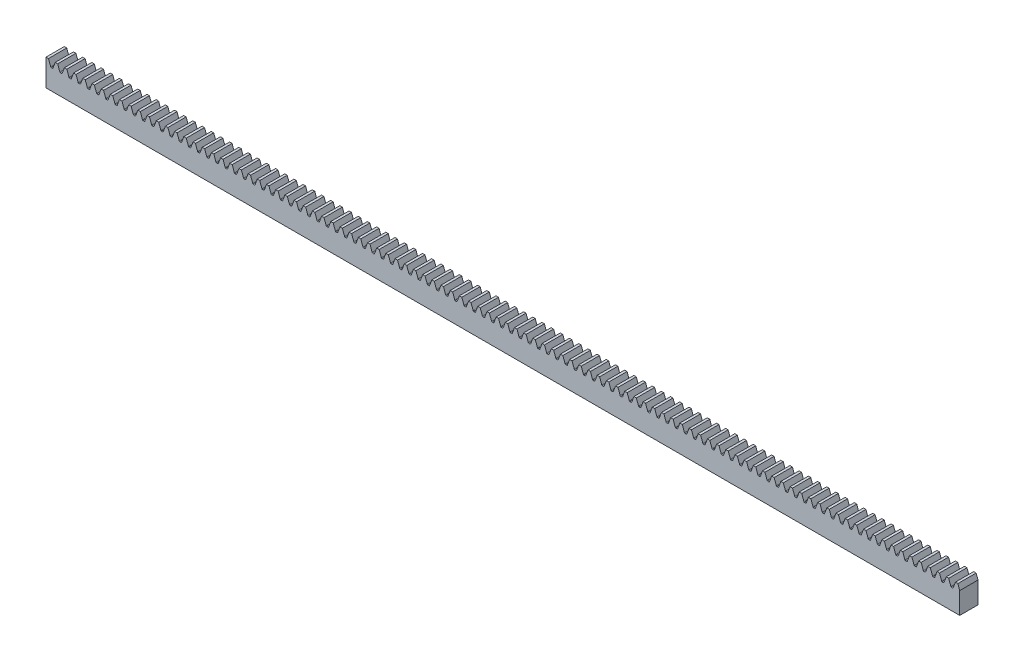
from build123d import *

# Parameters (mm, degrees)
BOSS_EXTRUDE1_DEPTH      = 125
BOSS_EXTRUDE1_DEPTH_BACK = 125
SKETCH3_W                = 5
SKETCH3_H                = 7.3
CUT_EXTRUDE1_DEPTH       = 126.078265498
FILLET1_R                = 0.167343945
LPATTERN1_START          = -2.5
LPATTERN1_DEPTH          = 5


# Read off the part's stored shape, not the designer's step: LPattern1
with BuildPart() as part:
    # Sketch3 → Boss-Extrude1 (new, two sides: drawn at the far end of the back side and taken through both)
    with BuildSketch(Plane(origin=(0, 0, 0), x_dir=(0, 0, -1), z_dir=(1, 0, 0)).offset(-BOSS_EXTRUDE1_DEPTH_BACK)):
        Rectangle(SKETCH3_W, SKETCH3_H)
    extrude(amount=BOSS_EXTRUDE1_DEPTH + BOSS_EXTRUDE1_DEPTH_BACK)

    # Sketch4 → Cut-Extrude1 (cut, symmetric)
    with BuildSketch(Plane.XY):
        Polygon((-124.325716375, 3.65), (-123.685128763, 1.89), (-123.127315612, 1.89), (-122.486728, 3.65), align=None)
    extrude(amount=CUT_EXTRUDE1_DEPTH, both=True, mode=Mode.SUBTRACT)

    # Fillet1
    fillet1_edges = [part.edges().sort_by_distance(p)[0] for p in [
        (-123.127315612, 1.89, 0),
        (-123.685128763, 1.89, 0),
    ]]
    fillet(fillet1_edges, radius=FILLET1_R)

    # LPattern1 outline → LPattern1 (cut)
    with BuildSketch(Plane.XY.offset(LPATTERN1_START)):
        with BuildLine():
            ThreePointArc((-121.211933141, 2.000108945), (-121.150665815, 1.92026381), (-121.054681271, 1.89))
            Line((-121.054681271, 1.89), (-120.731219104, 1.89))
            ThreePointArc((-120.731219104, 1.89), (-120.63523456, 1.92026381), (-120.573967234, 2.000108945))
            Line((-120.573967234, 2.000108945), (-119.973456, 3.65))
            Line((-119.973456, 3.65), (-121.812444375, 3.65))
            Line((-121.812444375, 3.65), (-121.211933141, 2.000108945))
        make_face()
        Polygon((125, 3.65), (124.488211625, 3.65), (125, 2.243872997), align=None)
        with BuildLine():
            Line((123.813928, 3.65), (121.974939625, 3.65))
            Line((121.974939625, 3.65), (122.575450859, 2.000108945))
            ThreePointArc((122.575450859, 2.000108945), (122.636718185, 1.92026381), (122.732702729, 1.89))
            Line((122.732702729, 1.89), (123.056164896, 1.89))
            ThreePointArc((123.056164896, 1.89), (123.15214944, 1.92026381), (123.213416766, 2.000108945))
            Line((123.213416766, 2.000108945), (123.813928, 3.65))
        make_face()
        with BuildLine():
            Line((121.300656, 3.65), (119.461667625, 3.65))
            Line((119.461667625, 3.65), (120.062178859, 2.000108945))
            ThreePointArc((120.062178859, 2.000108945), (120.123446185, 1.92026381), (120.219430729, 1.89))
            Line((120.219430729, 1.89), (120.542892896, 1.89))
            ThreePointArc((120.542892896, 1.89), (120.63887744, 1.92026381), (120.700144766, 2.000108945))
            Line((120.700144766, 2.000108945), (121.300656, 3.65))
        make_face()
        with BuildLine():
            Line((118.787384, 3.65), (116.948395625, 3.65))
            Line((116.948395625, 3.65), (117.548906859, 2.000108945))
            ThreePointArc((117.548906859, 2.000108945), (117.610174185, 1.92026381), (117.706158729, 1.89))
            Line((117.706158729, 1.89), (118.029620896, 1.89))
            ThreePointArc((118.029620896, 1.89), (118.12560544, 1.92026381), (118.186872766, 2.000108945))
            Line((118.186872766, 2.000108945), (118.787384, 3.65))
        make_face()
        with BuildLine():
            Line((116.274112, 3.65), (114.435123625, 3.65))
            Line((114.435123625, 3.65), (115.035634859, 2.000108945))
            ThreePointArc((115.035634859, 2.000108945), (115.096902185, 1.92026381), (115.192886729, 1.89))
            Line((115.192886729, 1.89), (115.516348896, 1.89))
            ThreePointArc((115.516348896, 1.89), (115.61233344, 1.92026381), (115.673600766, 2.000108945))
            Line((115.673600766, 2.000108945), (116.274112, 3.65))
        make_face()
        with BuildLine():
            Line((113.76084, 3.65), (111.921851625, 3.65))
            Line((111.921851625, 3.65), (112.522362859, 2.000108945))
            ThreePointArc((112.522362859, 2.000108945), (112.583630185, 1.92026381), (112.679614729, 1.89))
            Line((112.679614729, 1.89), (113.003076896, 1.89))
            ThreePointArc((113.003076896, 1.89), (113.09906144, 1.92026381), (113.160328766, 2.000108945))
            Line((113.160328766, 2.000108945), (113.76084, 3.65))
        make_face()
        with BuildLine():
            Line((111.247568, 3.65), (109.408579625, 3.65))
            Line((109.408579625, 3.65), (110.009090859, 2.000108945))
            ThreePointArc((110.009090859, 2.000108945), (110.070358185, 1.92026381), (110.166342729, 1.89))
            Line((110.166342729, 1.89), (110.489804896, 1.89))
            ThreePointArc((110.489804896, 1.89), (110.58578944, 1.92026381), (110.647056766, 2.000108945))
            Line((110.647056766, 2.000108945), (111.247568, 3.65))
        make_face()
        with BuildLine():
            Line((108.734296, 3.65), (106.895307625, 3.65))
            Line((106.895307625, 3.65), (107.495818859, 2.000108945))
            ThreePointArc((107.495818859, 2.000108945), (107.557086185, 1.92026381), (107.653070729, 1.89))
            Line((107.653070729, 1.89), (107.976532896, 1.89))
            ThreePointArc((107.976532896, 1.89), (108.07251744, 1.92026381), (108.133784766, 2.000108945))
            Line((108.133784766, 2.000108945), (108.734296, 3.65))
        make_face()
        with BuildLine():
            Line((106.221024, 3.65), (104.382035625, 3.65))
            Line((104.382035625, 3.65), (104.982546859, 2.000108945))
            ThreePointArc((104.982546859, 2.000108945), (105.043814185, 1.92026381), (105.139798729, 1.89))
            Line((105.139798729, 1.89), (105.463260896, 1.89))
            ThreePointArc((105.463260896, 1.89), (105.55924544, 1.92026381), (105.620512766, 2.000108945))
            Line((105.620512766, 2.000108945), (106.221024, 3.65))
        make_face()
        with BuildLine():
            Line((103.707752, 3.65), (101.868763625, 3.65))
            Line((101.868763625, 3.65), (102.469274859, 2.000108945))
            ThreePointArc((102.469274859, 2.000108945), (102.530542185, 1.92026381), (102.626526729, 1.89))
            Line((102.626526729, 1.89), (102.949988896, 1.89))
            ThreePointArc((102.949988896, 1.89), (103.04597344, 1.92026381), (103.107240766, 2.000108945))
            Line((103.107240766, 2.000108945), (103.707752, 3.65))
        make_face()
        with BuildLine():
            Line((101.19448, 3.65), (99.355491625, 3.65))
            Line((99.355491625, 3.65), (99.956002859, 2.000108945))
            ThreePointArc((99.956002859, 2.000108945), (100.017270185, 1.92026381), (100.113254729, 1.89))
            Line((100.113254729, 1.89), (100.436716896, 1.89))
            ThreePointArc((100.436716896, 1.89), (100.53270144, 1.92026381), (100.593968766, 2.000108945))
            Line((100.593968766, 2.000108945), (101.19448, 3.65))
        make_face()
        with BuildLine():
            Line((98.681208, 3.65), (96.842219625, 3.65))
            Line((96.842219625, 3.65), (97.442730859, 2.000108945))
            ThreePointArc((97.442730859, 2.000108945), (97.503998185, 1.92026381), (97.599982729, 1.89))
            Line((97.599982729, 1.89), (97.923444896, 1.89))
            ThreePointArc((97.923444896, 1.89), (98.01942944, 1.92026381), (98.080696766, 2.000108945))
            Line((98.080696766, 2.000108945), (98.681208, 3.65))
        make_face()
        with BuildLine():
            Line((96.167936, 3.65), (94.328947625, 3.65))
            Line((94.328947625, 3.65), (94.929458859, 2.000108945))
            ThreePointArc((94.929458859, 2.000108945), (94.990726185, 1.92026381), (95.086710729, 1.89))
            Line((95.086710729, 1.89), (95.410172896, 1.89))
            ThreePointArc((95.410172896, 1.89), (95.50615744, 1.92026381), (95.567424766, 2.000108945))
            Line((95.567424766, 2.000108945), (96.167936, 3.65))
        make_face()
        with BuildLine():
            Line((93.654664, 3.65), (91.815675625, 3.65))
            Line((91.815675625, 3.65), (92.416186859, 2.000108945))
            ThreePointArc((92.416186859, 2.000108945), (92.477454185, 1.92026381), (92.573438729, 1.89))
            Line((92.573438729, 1.89), (92.896900896, 1.89))
            ThreePointArc((92.896900896, 1.89), (92.99288544, 1.92026381), (93.054152766, 2.000108945))
            Line((93.054152766, 2.000108945), (93.654664, 3.65))
        make_face()
        with BuildLine():
            Line((91.141392, 3.65), (89.302403625, 3.65))
            Line((89.302403625, 3.65), (89.902914859, 2.000108945))
            ThreePointArc((89.902914859, 2.000108945), (89.964182185, 1.92026381), (90.060166729, 1.89))
            Line((90.060166729, 1.89), (90.383628896, 1.89))
            ThreePointArc((90.383628896, 1.89), (90.47961344, 1.92026381), (90.540880766, 2.000108945))
            Line((90.540880766, 2.000108945), (91.141392, 3.65))
        make_face()
        with BuildLine():
            Line((88.62812, 3.65), (86.789131625, 3.65))
            Line((86.789131625, 3.65), (87.389642859, 2.000108945))
            ThreePointArc((87.389642859, 2.000108945), (87.450910185, 1.92026381), (87.546894729, 1.89))
            Line((87.546894729, 1.89), (87.870356896, 1.89))
            ThreePointArc((87.870356896, 1.89), (87.96634144, 1.92026381), (88.027608766, 2.000108945))
            Line((88.027608766, 2.000108945), (88.62812, 3.65))
        make_face()
        with BuildLine():
            Line((86.114848, 3.65), (84.275859625, 3.65))
            Line((84.275859625, 3.65), (84.876370859, 2.000108945))
            ThreePointArc((84.876370859, 2.000108945), (84.937638185, 1.92026381), (85.033622729, 1.89))
            Line((85.033622729, 1.89), (85.357084896, 1.89))
            ThreePointArc((85.357084896, 1.89), (85.45306944, 1.92026381), (85.514336766, 2.000108945))
            Line((85.514336766, 2.000108945), (86.114848, 3.65))
        make_face()
        with BuildLine():
            Line((83.601576, 3.65), (81.762587625, 3.65))
            Line((81.762587625, 3.65), (82.363098859, 2.000108945))
            ThreePointArc((82.363098859, 2.000108945), (82.424366185, 1.92026381), (82.520350729, 1.89))
            Line((82.520350729, 1.89), (82.843812896, 1.89))
            ThreePointArc((82.843812896, 1.89), (82.93979744, 1.92026381), (83.001064766, 2.000108945))
            Line((83.001064766, 2.000108945), (83.601576, 3.65))
        make_face()
        with BuildLine():
            Line((81.088304, 3.65), (79.249315625, 3.65))
            Line((79.249315625, 3.65), (79.849826859, 2.000108945))
            ThreePointArc((79.849826859, 2.000108945), (79.911094185, 1.92026381), (80.007078729, 1.89))
            Line((80.007078729, 1.89), (80.330540896, 1.89))
            ThreePointArc((80.330540896, 1.89), (80.42652544, 1.92026381), (80.487792766, 2.000108945))
            Line((80.487792766, 2.000108945), (81.088304, 3.65))
        make_face()
        with BuildLine():
            Line((78.575032, 3.65), (76.736043625, 3.65))
            Line((76.736043625, 3.65), (77.336554859, 2.000108945))
            ThreePointArc((77.336554859, 2.000108945), (77.397822185, 1.92026381), (77.493806729, 1.89))
            Line((77.493806729, 1.89), (77.817268896, 1.89))
            ThreePointArc((77.817268896, 1.89), (77.91325344, 1.92026381), (77.974520766, 2.000108945))
            Line((77.974520766, 2.000108945), (78.575032, 3.65))
        make_face()
        with BuildLine():
            Line((76.06176, 3.65), (74.222771625, 3.65))
            Line((74.222771625, 3.65), (74.823282859, 2.000108945))
            ThreePointArc((74.823282859, 2.000108945), (74.884550185, 1.92026381), (74.980534729, 1.89))
            Line((74.980534729, 1.89), (75.303996896, 1.89))
            ThreePointArc((75.303996896, 1.89), (75.39998144, 1.92026381), (75.461248766, 2.000108945))
            Line((75.461248766, 2.000108945), (76.06176, 3.65))
        make_face()
        with BuildLine():
            Line((73.548488, 3.65), (71.709499625, 3.65))
            Line((71.709499625, 3.65), (72.310010859, 2.000108945))
            ThreePointArc((72.310010859, 2.000108945), (72.371278185, 1.92026381), (72.467262729, 1.89))
            Line((72.467262729, 1.89), (72.790724896, 1.89))
            ThreePointArc((72.790724896, 1.89), (72.88670944, 1.92026381), (72.947976766, 2.000108945))
            Line((72.947976766, 2.000108945), (73.548488, 3.65))
        make_face()
        with BuildLine():
            Line((71.035216, 3.65), (69.196227625, 3.65))
            Line((69.196227625, 3.65), (69.796738859, 2.000108945))
            ThreePointArc((69.796738859, 2.000108945), (69.858006185, 1.92026381), (69.953990729, 1.89))
            Line((69.953990729, 1.89), (70.277452896, 1.89))
            ThreePointArc((70.277452896, 1.89), (70.37343744, 1.92026381), (70.434704766, 2.000108945))
            Line((70.434704766, 2.000108945), (71.035216, 3.65))
        make_face()
        with BuildLine():
            Line((68.521944, 3.65), (66.682955625, 3.65))
            Line((66.682955625, 3.65), (67.283466859, 2.000108945))
            ThreePointArc((67.283466859, 2.000108945), (67.344734185, 1.92026381), (67.440718729, 1.89))
            Line((67.440718729, 1.89), (67.764180896, 1.89))
            ThreePointArc((67.764180896, 1.89), (67.86016544, 1.92026381), (67.921432766, 2.000108945))
            Line((67.921432766, 2.000108945), (68.521944, 3.65))
        make_face()
        with BuildLine():
            Line((66.008672, 3.65), (64.169683625, 3.65))
            Line((64.169683625, 3.65), (64.770194859, 2.000108945))
            ThreePointArc((64.770194859, 2.000108945), (64.831462185, 1.92026381), (64.927446729, 1.89))
            Line((64.927446729, 1.89), (65.250908896, 1.89))
            ThreePointArc((65.250908896, 1.89), (65.34689344, 1.92026381), (65.408160766, 2.000108945))
            Line((65.408160766, 2.000108945), (66.008672, 3.65))
        make_face()
        with BuildLine():
            Line((63.4954, 3.65), (61.656411625, 3.65))
            Line((61.656411625, 3.65), (62.256922859, 2.000108945))
            ThreePointArc((62.256922859, 2.000108945), (62.318190185, 1.92026381), (62.414174729, 1.89))
            Line((62.414174729, 1.89), (62.737636896, 1.89))
            ThreePointArc((62.737636896, 1.89), (62.83362144, 1.92026381), (62.894888766, 2.000108945))
            Line((62.894888766, 2.000108945), (63.4954, 3.65))
        make_face()
        with BuildLine():
            Line((60.982128, 3.65), (59.143139625, 3.65))
            Line((59.143139625, 3.65), (59.743650859, 2.000108945))
            ThreePointArc((59.743650859, 2.000108945), (59.804918185, 1.92026381), (59.900902729, 1.89))
            Line((59.900902729, 1.89), (60.224364896, 1.89))
            ThreePointArc((60.224364896, 1.89), (60.32034944, 1.92026381), (60.381616766, 2.000108945))
            Line((60.381616766, 2.000108945), (60.982128, 3.65))
        make_face()
        with BuildLine():
            Line((58.468856, 3.65), (56.629867625, 3.65))
            Line((56.629867625, 3.65), (57.230378859, 2.000108945))
            ThreePointArc((57.230378859, 2.000108945), (57.291646185, 1.92026381), (57.387630729, 1.89))
            Line((57.387630729, 1.89), (57.711092896, 1.89))
            ThreePointArc((57.711092896, 1.89), (57.80707744, 1.92026381), (57.868344766, 2.000108945))
            Line((57.868344766, 2.000108945), (58.468856, 3.65))
        make_face()
        with BuildLine():
            Line((55.955584, 3.65), (54.116595625, 3.65))
            Line((54.116595625, 3.65), (54.717106859, 2.000108945))
            ThreePointArc((54.717106859, 2.000108945), (54.778374185, 1.92026381), (54.874358729, 1.89))
            Line((54.874358729, 1.89), (55.197820896, 1.89))
            ThreePointArc((55.197820896, 1.89), (55.29380544, 1.92026381), (55.355072766, 2.000108945))
            Line((55.355072766, 2.000108945), (55.955584, 3.65))
        make_face()
        with BuildLine():
            Line((53.442312, 3.65), (51.603323625, 3.65))
            Line((51.603323625, 3.65), (52.203834859, 2.000108945))
            ThreePointArc((52.203834859, 2.000108945), (52.265102185, 1.92026381), (52.361086729, 1.89))
            Line((52.361086729, 1.89), (52.684548896, 1.89))
            ThreePointArc((52.684548896, 1.89), (52.78053344, 1.92026381), (52.841800766, 2.000108945))
            Line((52.841800766, 2.000108945), (53.442312, 3.65))
        make_face()
        with BuildLine():
            Line((50.92904, 3.65), (49.090051625, 3.65))
            Line((49.090051625, 3.65), (49.690562859, 2.000108945))
            ThreePointArc((49.690562859, 2.000108945), (49.751830185, 1.92026381), (49.847814729, 1.89))
            Line((49.847814729, 1.89), (50.171276896, 1.89))
            ThreePointArc((50.171276896, 1.89), (50.26726144, 1.92026381), (50.328528766, 2.000108945))
            Line((50.328528766, 2.000108945), (50.92904, 3.65))
        make_face()
        with BuildLine():
            Line((48.415768, 3.65), (46.576779625, 3.65))
            Line((46.576779625, 3.65), (47.177290859, 2.000108945))
            ThreePointArc((47.177290859, 2.000108945), (47.238558185, 1.92026381), (47.334542729, 1.89))
            Line((47.334542729, 1.89), (47.658004896, 1.89))
            ThreePointArc((47.658004896, 1.89), (47.75398944, 1.92026381), (47.815256766, 2.000108945))
            Line((47.815256766, 2.000108945), (48.415768, 3.65))
        make_face()
        with BuildLine():
            Line((45.902496, 3.65), (44.063507625, 3.65))
            Line((44.063507625, 3.65), (44.664018859, 2.000108945))
            ThreePointArc((44.664018859, 2.000108945), (44.725286185, 1.92026381), (44.821270729, 1.89))
            Line((44.821270729, 1.89), (45.144732896, 1.89))
            ThreePointArc((45.144732896, 1.89), (45.24071744, 1.92026381), (45.301984766, 2.000108945))
            Line((45.301984766, 2.000108945), (45.902496, 3.65))
        make_face()
        with BuildLine():
            Line((43.389224, 3.65), (41.550235625, 3.65))
            Line((41.550235625, 3.65), (42.150746859, 2.000108945))
            ThreePointArc((42.150746859, 2.000108945), (42.212014185, 1.92026381), (42.307998729, 1.89))
            Line((42.307998729, 1.89), (42.631460896, 1.89))
            ThreePointArc((42.631460896, 1.89), (42.72744544, 1.92026381), (42.788712766, 2.000108945))
            Line((42.788712766, 2.000108945), (43.389224, 3.65))
        make_face()
        with BuildLine():
            Line((40.875952, 3.65), (39.036963625, 3.65))
            Line((39.036963625, 3.65), (39.637474859, 2.000108945))
            ThreePointArc((39.637474859, 2.000108945), (39.698742185, 1.92026381), (39.794726729, 1.89))
            Line((39.794726729, 1.89), (40.118188896, 1.89))
            ThreePointArc((40.118188896, 1.89), (40.21417344, 1.92026381), (40.275440766, 2.000108945))
            Line((40.275440766, 2.000108945), (40.875952, 3.65))
        make_face()
        with BuildLine():
            Line((38.36268, 3.65), (36.523691625, 3.65))
            Line((36.523691625, 3.65), (37.124202859, 2.000108945))
            ThreePointArc((37.124202859, 2.000108945), (37.185470185, 1.92026381), (37.281454729, 1.89))
            Line((37.281454729, 1.89), (37.604916896, 1.89))
            ThreePointArc((37.604916896, 1.89), (37.70090144, 1.92026381), (37.762168766, 2.000108945))
            Line((37.762168766, 2.000108945), (38.36268, 3.65))
        make_face()
        with BuildLine():
            Line((35.849408, 3.65), (34.010419625, 3.65))
            Line((34.010419625, 3.65), (34.610930859, 2.000108945))
            ThreePointArc((34.610930859, 2.000108945), (34.672198185, 1.92026381), (34.768182729, 1.89))
            Line((34.768182729, 1.89), (35.091644896, 1.89))
            ThreePointArc((35.091644896, 1.89), (35.18762944, 1.92026381), (35.248896766, 2.000108945))
            Line((35.248896766, 2.000108945), (35.849408, 3.65))
        make_face()
        with BuildLine():
            Line((33.336136, 3.65), (31.497147625, 3.65))
            Line((31.497147625, 3.65), (32.097658859, 2.000108945))
            ThreePointArc((32.097658859, 2.000108945), (32.158926185, 1.92026381), (32.254910729, 1.89))
            Line((32.254910729, 1.89), (32.578372896, 1.89))
            ThreePointArc((32.578372896, 1.89), (32.67435744, 1.92026381), (32.735624766, 2.000108945))
            Line((32.735624766, 2.000108945), (33.336136, 3.65))
        make_face()
        with BuildLine():
            Line((30.822864, 3.65), (28.983875625, 3.65))
            Line((28.983875625, 3.65), (29.584386859, 2.000108945))
            ThreePointArc((29.584386859, 2.000108945), (29.645654185, 1.92026381), (29.741638729, 1.89))
            Line((29.741638729, 1.89), (30.065100896, 1.89))
            ThreePointArc((30.065100896, 1.89), (30.16108544, 1.92026381), (30.222352766, 2.000108945))
            Line((30.222352766, 2.000108945), (30.822864, 3.65))
        make_face()
        with BuildLine():
            Line((28.309592, 3.65), (26.470603625, 3.65))
            Line((26.470603625, 3.65), (27.071114859, 2.000108945))
            ThreePointArc((27.071114859, 2.000108945), (27.132382185, 1.92026381), (27.228366729, 1.89))
            Line((27.228366729, 1.89), (27.551828896, 1.89))
            ThreePointArc((27.551828896, 1.89), (27.64781344, 1.92026381), (27.709080766, 2.000108945))
            Line((27.709080766, 2.000108945), (28.309592, 3.65))
        make_face()
        with BuildLine():
            Line((25.79632, 3.65), (23.957331625, 3.65))
            Line((23.957331625, 3.65), (24.557842859, 2.000108945))
            ThreePointArc((24.557842859, 2.000108945), (24.619110185, 1.92026381), (24.715094729, 1.89))
            Line((24.715094729, 1.89), (25.038556896, 1.89))
            ThreePointArc((25.038556896, 1.89), (25.13454144, 1.92026381), (25.195808766, 2.000108945))
            Line((25.195808766, 2.000108945), (25.79632, 3.65))
        make_face()
        with BuildLine():
            Line((23.283048, 3.65), (21.444059625, 3.65))
            Line((21.444059625, 3.65), (22.044570859, 2.000108945))
            ThreePointArc((22.044570859, 2.000108945), (22.105838185, 1.92026381), (22.201822729, 1.89))
            Line((22.201822729, 1.89), (22.525284896, 1.89))
            ThreePointArc((22.525284896, 1.89), (22.62126944, 1.92026381), (22.682536766, 2.000108945))
            Line((22.682536766, 2.000108945), (23.283048, 3.65))
        make_face()
        with BuildLine():
            Line((20.769776, 3.65), (18.930787625, 3.65))
            Line((18.930787625, 3.65), (19.531298859, 2.000108945))
            ThreePointArc((19.531298859, 2.000108945), (19.592566185, 1.92026381), (19.688550729, 1.89))
            Line((19.688550729, 1.89), (20.012012896, 1.89))
            ThreePointArc((20.012012896, 1.89), (20.10799744, 1.92026381), (20.169264766, 2.000108945))
            Line((20.169264766, 2.000108945), (20.769776, 3.65))
        make_face()
        with BuildLine():
            Line((18.256504, 3.65), (16.417515625, 3.65))
            Line((16.417515625, 3.65), (17.018026859, 2.000108945))
            ThreePointArc((17.018026859, 2.000108945), (17.079294185, 1.92026381), (17.175278729, 1.89))
            Line((17.175278729, 1.89), (17.498740896, 1.89))
            ThreePointArc((17.498740896, 1.89), (17.59472544, 1.92026381), (17.655992766, 2.000108945))
            Line((17.655992766, 2.000108945), (18.256504, 3.65))
        make_face()
        with BuildLine():
            Line((15.743232, 3.65), (13.904243625, 3.65))
            Line((13.904243625, 3.65), (14.504754859, 2.000108945))
            ThreePointArc((14.504754859, 2.000108945), (14.566022185, 1.92026381), (14.662006729, 1.89))
            Line((14.662006729, 1.89), (14.985468896, 1.89))
            ThreePointArc((14.985468896, 1.89), (15.08145344, 1.92026381), (15.142720766, 2.000108945))
            Line((15.142720766, 2.000108945), (15.743232, 3.65))
        make_face()
        with BuildLine():
            Line((13.22996, 3.65), (11.390971625, 3.65))
            Line((11.390971625, 3.65), (11.991482859, 2.000108945))
            ThreePointArc((11.991482859, 2.000108945), (12.052750185, 1.92026381), (12.148734729, 1.89))
            Line((12.148734729, 1.89), (12.472196896, 1.89))
            ThreePointArc((12.472196896, 1.89), (12.56818144, 1.92026381), (12.629448766, 2.000108945))
            Line((12.629448766, 2.000108945), (13.22996, 3.65))
        make_face()
        with BuildLine():
            Line((10.716688, 3.65), (8.877699625, 3.65))
            Line((8.877699625, 3.65), (9.478210859, 2.000108945))
            ThreePointArc((9.478210859, 2.000108945), (9.539478185, 1.92026381), (9.635462729, 1.89))
            Line((9.635462729, 1.89), (9.958924896, 1.89))
            ThreePointArc((9.958924896, 1.89), (10.05490944, 1.92026381), (10.116176766, 2.000108945))
            Line((10.116176766, 2.000108945), (10.716688, 3.65))
        make_face()
        with BuildLine():
            Line((8.203416, 3.65), (6.364427625, 3.65))
            Line((6.364427625, 3.65), (6.964938859, 2.000108945))
            ThreePointArc((6.964938859, 2.000108945), (7.026206185, 1.92026381), (7.122190729, 1.89))
            Line((7.122190729, 1.89), (7.445652896, 1.89))
            ThreePointArc((7.445652896, 1.89), (7.54163744, 1.92026381), (7.602904766, 2.000108945))
            Line((7.602904766, 2.000108945), (8.203416, 3.65))
        make_face()
        with BuildLine():
            Line((5.690144, 3.65), (3.851155625, 3.65))
            Line((3.851155625, 3.65), (4.451666859, 2.000108945))
            ThreePointArc((4.451666859, 2.000108945), (4.512934185, 1.92026381), (4.608918729, 1.89))
            Line((4.608918729, 1.89), (4.932380896, 1.89))
            ThreePointArc((4.932380896, 1.89), (5.02836544, 1.92026381), (5.089632766, 2.000108945))
            Line((5.089632766, 2.000108945), (5.690144, 3.65))
        make_face()
        with BuildLine():
            Line((3.176872, 3.65), (1.337883625, 3.65))
            Line((1.337883625, 3.65), (1.938394859, 2.000108945))
            ThreePointArc((1.938394859, 2.000108945), (1.999662185, 1.92026381), (2.095646729, 1.89))
            Line((2.095646729, 1.89), (2.419108896, 1.89))
            ThreePointArc((2.419108896, 1.89), (2.51509344, 1.92026381), (2.576360766, 2.000108945))
            Line((2.576360766, 2.000108945), (3.176872, 3.65))
        make_face()
        with BuildLine():
            Line((0.6636, 3.65), (-1.175388375, 3.65))
            Line((-1.175388375, 3.65), (-0.574877141, 2.000108945))
            ThreePointArc((-0.574877141, 2.000108945), (-0.513609815, 1.92026381), (-0.417625271, 1.89))
            Line((-0.417625271, 1.89), (-0.094163104, 1.89))
            ThreePointArc((-0.094163104, 1.89), (0.00182144, 1.92026381), (0.063088766, 2.000108945))
            Line((0.063088766, 2.000108945), (0.6636, 3.65))
        make_face()
        with BuildLine():
            Line((-1.849672, 3.65), (-3.688660375, 3.65))
            Line((-3.688660375, 3.65), (-3.088149141, 2.000108945))
            ThreePointArc((-3.088149141, 2.000108945), (-3.026881815, 1.92026381), (-2.930897271, 1.89))
            Line((-2.930897271, 1.89), (-2.607435104, 1.89))
            ThreePointArc((-2.607435104, 1.89), (-2.51145056, 1.92026381), (-2.450183234, 2.000108945))
            Line((-2.450183234, 2.000108945), (-1.849672, 3.65))
        make_face()
        with BuildLine():
            Line((-4.362944, 3.65), (-6.201932375, 3.65))
            Line((-6.201932375, 3.65), (-5.601421141, 2.000108945))
            ThreePointArc((-5.601421141, 2.000108945), (-5.540153815, 1.92026381), (-5.444169271, 1.89))
            Line((-5.444169271, 1.89), (-5.120707104, 1.89))
            ThreePointArc((-5.120707104, 1.89), (-5.02472256, 1.92026381), (-4.963455234, 2.000108945))
            Line((-4.963455234, 2.000108945), (-4.362944, 3.65))
        make_face()
        with BuildLine():
            Line((-6.876216, 3.65), (-8.715204375, 3.65))
            Line((-8.715204375, 3.65), (-8.114693141, 2.000108945))
            ThreePointArc((-8.114693141, 2.000108945), (-8.053425815, 1.92026381), (-7.957441271, 1.89))
            Line((-7.957441271, 1.89), (-7.633979104, 1.89))
            ThreePointArc((-7.633979104, 1.89), (-7.53799456, 1.92026381), (-7.476727234, 2.000108945))
            Line((-7.476727234, 2.000108945), (-6.876216, 3.65))
        make_face()
        with BuildLine():
            Line((-9.389488, 3.65), (-11.228476375, 3.65))
            Line((-11.228476375, 3.65), (-10.627965141, 2.000108945))
            ThreePointArc((-10.627965141, 2.000108945), (-10.566697815, 1.92026381), (-10.470713271, 1.89))
            Line((-10.470713271, 1.89), (-10.147251104, 1.89))
            ThreePointArc((-10.147251104, 1.89), (-10.05126656, 1.92026381), (-9.989999234, 2.000108945))
            Line((-9.989999234, 2.000108945), (-9.389488, 3.65))
        make_face()
        with BuildLine():
            Line((-11.90276, 3.65), (-13.741748375, 3.65))
            Line((-13.741748375, 3.65), (-13.141237141, 2.000108945))
            ThreePointArc((-13.141237141, 2.000108945), (-13.079969815, 1.92026381), (-12.983985271, 1.89))
            Line((-12.983985271, 1.89), (-12.660523104, 1.89))
            ThreePointArc((-12.660523104, 1.89), (-12.56453856, 1.92026381), (-12.503271234, 2.000108945))
            Line((-12.503271234, 2.000108945), (-11.90276, 3.65))
        make_face()
        with BuildLine():
            Line((-14.416032, 3.65), (-16.255020375, 3.65))
            Line((-16.255020375, 3.65), (-15.654509141, 2.000108945))
            ThreePointArc((-15.654509141, 2.000108945), (-15.593241815, 1.92026381), (-15.497257271, 1.89))
            Line((-15.497257271, 1.89), (-15.173795104, 1.89))
            ThreePointArc((-15.173795104, 1.89), (-15.07781056, 1.92026381), (-15.016543234, 2.000108945))
            Line((-15.016543234, 2.000108945), (-14.416032, 3.65))
        make_face()
        with BuildLine():
            Line((-16.929304, 3.65), (-18.768292375, 3.65))
            Line((-18.768292375, 3.65), (-18.167781141, 2.000108945))
            ThreePointArc((-18.167781141, 2.000108945), (-18.106513815, 1.92026381), (-18.010529271, 1.89))
            Line((-18.010529271, 1.89), (-17.687067104, 1.89))
            ThreePointArc((-17.687067104, 1.89), (-17.59108256, 1.92026381), (-17.529815234, 2.000108945))
            Line((-17.529815234, 2.000108945), (-16.929304, 3.65))
        make_face()
        with BuildLine():
            Line((-19.442576, 3.65), (-21.281564375, 3.65))
            Line((-21.281564375, 3.65), (-20.681053141, 2.000108945))
            ThreePointArc((-20.681053141, 2.000108945), (-20.619785815, 1.92026381), (-20.523801271, 1.89))
            Line((-20.523801271, 1.89), (-20.200339104, 1.89))
            ThreePointArc((-20.200339104, 1.89), (-20.10435456, 1.92026381), (-20.043087234, 2.000108945))
            Line((-20.043087234, 2.000108945), (-19.442576, 3.65))
        make_face()
        with BuildLine():
            Line((-21.955848, 3.65), (-23.794836375, 3.65))
            Line((-23.794836375, 3.65), (-23.194325141, 2.000108945))
            ThreePointArc((-23.194325141, 2.000108945), (-23.133057815, 1.92026381), (-23.037073271, 1.89))
            Line((-23.037073271, 1.89), (-22.713611104, 1.89))
            ThreePointArc((-22.713611104, 1.89), (-22.61762656, 1.92026381), (-22.556359234, 2.000108945))
            Line((-22.556359234, 2.000108945), (-21.955848, 3.65))
        make_face()
        with BuildLine():
            Line((-24.46912, 3.65), (-26.308108375, 3.65))
            Line((-26.308108375, 3.65), (-25.707597141, 2.000108945))
            ThreePointArc((-25.707597141, 2.000108945), (-25.646329815, 1.92026381), (-25.550345271, 1.89))
            Line((-25.550345271, 1.89), (-25.226883104, 1.89))
            ThreePointArc((-25.226883104, 1.89), (-25.13089856, 1.92026381), (-25.069631234, 2.000108945))
            Line((-25.069631234, 2.000108945), (-24.46912, 3.65))
        make_face()
        with BuildLine():
            Line((-26.982392, 3.65), (-28.821380375, 3.65))
            Line((-28.821380375, 3.65), (-28.220869141, 2.000108945))
            ThreePointArc((-28.220869141, 2.000108945), (-28.159601815, 1.92026381), (-28.063617271, 1.89))
            Line((-28.063617271, 1.89), (-27.740155104, 1.89))
            ThreePointArc((-27.740155104, 1.89), (-27.64417056, 1.92026381), (-27.582903234, 2.000108945))
            Line((-27.582903234, 2.000108945), (-26.982392, 3.65))
        make_face()
        with BuildLine():
            Line((-29.495664, 3.65), (-31.334652375, 3.65))
            Line((-31.334652375, 3.65), (-30.734141141, 2.000108945))
            ThreePointArc((-30.734141141, 2.000108945), (-30.672873815, 1.92026381), (-30.576889271, 1.89))
            Line((-30.576889271, 1.89), (-30.253427104, 1.89))
            ThreePointArc((-30.253427104, 1.89), (-30.15744256, 1.92026381), (-30.096175234, 2.000108945))
            Line((-30.096175234, 2.000108945), (-29.495664, 3.65))
        make_face()
        with BuildLine():
            Line((-32.008936, 3.65), (-33.847924375, 3.65))
            Line((-33.847924375, 3.65), (-33.247413141, 2.000108945))
            ThreePointArc((-33.247413141, 2.000108945), (-33.186145815, 1.92026381), (-33.090161271, 1.89))
            Line((-33.090161271, 1.89), (-32.766699104, 1.89))
            ThreePointArc((-32.766699104, 1.89), (-32.67071456, 1.92026381), (-32.609447234, 2.000108945))
            Line((-32.609447234, 2.000108945), (-32.008936, 3.65))
        make_face()
        with BuildLine():
            Line((-34.522208, 3.65), (-36.361196375, 3.65))
            Line((-36.361196375, 3.65), (-35.760685141, 2.000108945))
            ThreePointArc((-35.760685141, 2.000108945), (-35.699417815, 1.92026381), (-35.603433271, 1.89))
            Line((-35.603433271, 1.89), (-35.279971104, 1.89))
            ThreePointArc((-35.279971104, 1.89), (-35.18398656, 1.92026381), (-35.122719234, 2.000108945))
            Line((-35.122719234, 2.000108945), (-34.522208, 3.65))
        make_face()
        with BuildLine():
            Line((-37.03548, 3.65), (-38.874468375, 3.65))
            Line((-38.874468375, 3.65), (-38.273957141, 2.000108945))
            ThreePointArc((-38.273957141, 2.000108945), (-38.212689815, 1.92026381), (-38.116705271, 1.89))
            Line((-38.116705271, 1.89), (-37.793243104, 1.89))
            ThreePointArc((-37.793243104, 1.89), (-37.69725856, 1.92026381), (-37.635991234, 2.000108945))
            Line((-37.635991234, 2.000108945), (-37.03548, 3.65))
        make_face()
        with BuildLine():
            Line((-39.548752, 3.65), (-41.387740375, 3.65))
            Line((-41.387740375, 3.65), (-40.787229141, 2.000108945))
            ThreePointArc((-40.787229141, 2.000108945), (-40.725961815, 1.92026381), (-40.629977271, 1.89))
            Line((-40.629977271, 1.89), (-40.306515104, 1.89))
            ThreePointArc((-40.306515104, 1.89), (-40.21053056, 1.92026381), (-40.149263234, 2.000108945))
            Line((-40.149263234, 2.000108945), (-39.548752, 3.65))
        make_face()
        with BuildLine():
            Line((-42.062024, 3.65), (-43.901012375, 3.65))
            Line((-43.901012375, 3.65), (-43.300501141, 2.000108945))
            ThreePointArc((-43.300501141, 2.000108945), (-43.239233815, 1.92026381), (-43.143249271, 1.89))
            Line((-43.143249271, 1.89), (-42.819787104, 1.89))
            ThreePointArc((-42.819787104, 1.89), (-42.72380256, 1.92026381), (-42.662535234, 2.000108945))
            Line((-42.662535234, 2.000108945), (-42.062024, 3.65))
        make_face()
        with BuildLine():
            Line((-44.575296, 3.65), (-46.414284375, 3.65))
            Line((-46.414284375, 3.65), (-45.813773141, 2.000108945))
            ThreePointArc((-45.813773141, 2.000108945), (-45.752505815, 1.92026381), (-45.656521271, 1.89))
            Line((-45.656521271, 1.89), (-45.333059104, 1.89))
            ThreePointArc((-45.333059104, 1.89), (-45.23707456, 1.92026381), (-45.175807234, 2.000108945))
            Line((-45.175807234, 2.000108945), (-44.575296, 3.65))
        make_face()
        with BuildLine():
            Line((-47.088568, 3.65), (-48.927556375, 3.65))
            Line((-48.927556375, 3.65), (-48.327045141, 2.000108945))
            ThreePointArc((-48.327045141, 2.000108945), (-48.265777815, 1.92026381), (-48.169793271, 1.89))
            Line((-48.169793271, 1.89), (-47.846331104, 1.89))
            ThreePointArc((-47.846331104, 1.89), (-47.75034656, 1.92026381), (-47.689079234, 2.000108945))
            Line((-47.689079234, 2.000108945), (-47.088568, 3.65))
        make_face()
        with BuildLine():
            Line((-49.60184, 3.65), (-51.440828375, 3.65))
            Line((-51.440828375, 3.65), (-50.840317141, 2.000108945))
            ThreePointArc((-50.840317141, 2.000108945), (-50.779049815, 1.92026381), (-50.683065271, 1.89))
            Line((-50.683065271, 1.89), (-50.359603104, 1.89))
            ThreePointArc((-50.359603104, 1.89), (-50.26361856, 1.92026381), (-50.202351234, 2.000108945))
            Line((-50.202351234, 2.000108945), (-49.60184, 3.65))
        make_face()
        with BuildLine():
            Line((-52.115112, 3.65), (-53.954100375, 3.65))
            Line((-53.954100375, 3.65), (-53.353589141, 2.000108945))
            ThreePointArc((-53.353589141, 2.000108945), (-53.292321815, 1.92026381), (-53.196337271, 1.89))
            Line((-53.196337271, 1.89), (-52.872875104, 1.89))
            ThreePointArc((-52.872875104, 1.89), (-52.77689056, 1.92026381), (-52.715623234, 2.000108945))
            Line((-52.715623234, 2.000108945), (-52.115112, 3.65))
        make_face()
        with BuildLine():
            Line((-54.628384, 3.65), (-56.467372375, 3.65))
            Line((-56.467372375, 3.65), (-55.866861141, 2.000108945))
            ThreePointArc((-55.866861141, 2.000108945), (-55.805593815, 1.92026381), (-55.709609271, 1.89))
            Line((-55.709609271, 1.89), (-55.386147104, 1.89))
            ThreePointArc((-55.386147104, 1.89), (-55.29016256, 1.92026381), (-55.228895234, 2.000108945))
            Line((-55.228895234, 2.000108945), (-54.628384, 3.65))
        make_face()
        with BuildLine():
            Line((-57.141656, 3.65), (-58.980644375, 3.65))
            Line((-58.980644375, 3.65), (-58.380133141, 2.000108945))
            ThreePointArc((-58.380133141, 2.000108945), (-58.318865815, 1.92026381), (-58.222881271, 1.89))
            Line((-58.222881271, 1.89), (-57.899419104, 1.89))
            ThreePointArc((-57.899419104, 1.89), (-57.80343456, 1.92026381), (-57.742167234, 2.000108945))
            Line((-57.742167234, 2.000108945), (-57.141656, 3.65))
        make_face()
        with BuildLine():
            Line((-59.654928, 3.65), (-61.493916375, 3.65))
            Line((-61.493916375, 3.65), (-60.893405141, 2.000108945))
            ThreePointArc((-60.893405141, 2.000108945), (-60.832137815, 1.92026381), (-60.736153271, 1.89))
            Line((-60.736153271, 1.89), (-60.412691104, 1.89))
            ThreePointArc((-60.412691104, 1.89), (-60.31670656, 1.92026381), (-60.255439234, 2.000108945))
            Line((-60.255439234, 2.000108945), (-59.654928, 3.65))
        make_face()
        with BuildLine():
            Line((-62.1682, 3.65), (-64.007188375, 3.65))
            Line((-64.007188375, 3.65), (-63.406677141, 2.000108945))
            ThreePointArc((-63.406677141, 2.000108945), (-63.345409815, 1.92026381), (-63.249425271, 1.89))
            Line((-63.249425271, 1.89), (-62.925963104, 1.89))
            ThreePointArc((-62.925963104, 1.89), (-62.82997856, 1.92026381), (-62.768711234, 2.000108945))
            Line((-62.768711234, 2.000108945), (-62.1682, 3.65))
        make_face()
        with BuildLine():
            Line((-64.681472, 3.65), (-66.520460375, 3.65))
            Line((-66.520460375, 3.65), (-65.919949141, 2.000108945))
            ThreePointArc((-65.919949141, 2.000108945), (-65.858681815, 1.92026381), (-65.762697271, 1.89))
            Line((-65.762697271, 1.89), (-65.439235104, 1.89))
            ThreePointArc((-65.439235104, 1.89), (-65.34325056, 1.92026381), (-65.281983234, 2.000108945))
            Line((-65.281983234, 2.000108945), (-64.681472, 3.65))
        make_face()
        with BuildLine():
            Line((-67.194744, 3.65), (-69.033732375, 3.65))
            Line((-69.033732375, 3.65), (-68.433221141, 2.000108945))
            ThreePointArc((-68.433221141, 2.000108945), (-68.371953815, 1.92026381), (-68.275969271, 1.89))
            Line((-68.275969271, 1.89), (-67.952507104, 1.89))
            ThreePointArc((-67.952507104, 1.89), (-67.85652256, 1.92026381), (-67.795255234, 2.000108945))
            Line((-67.795255234, 2.000108945), (-67.194744, 3.65))
        make_face()
        with BuildLine():
            Line((-69.708016, 3.65), (-71.547004375, 3.65))
            Line((-71.547004375, 3.65), (-70.946493141, 2.000108945))
            ThreePointArc((-70.946493141, 2.000108945), (-70.885225815, 1.92026381), (-70.789241271, 1.89))
            Line((-70.789241271, 1.89), (-70.465779104, 1.89))
            ThreePointArc((-70.465779104, 1.89), (-70.36979456, 1.92026381), (-70.308527234, 2.000108945))
            Line((-70.308527234, 2.000108945), (-69.708016, 3.65))
        make_face()
        with BuildLine():
            Line((-72.221288, 3.65), (-74.060276375, 3.65))
            Line((-74.060276375, 3.65), (-73.459765141, 2.000108945))
            ThreePointArc((-73.459765141, 2.000108945), (-73.398497815, 1.92026381), (-73.302513271, 1.89))
            Line((-73.302513271, 1.89), (-72.979051104, 1.89))
            ThreePointArc((-72.979051104, 1.89), (-72.88306656, 1.92026381), (-72.821799234, 2.000108945))
            Line((-72.821799234, 2.000108945), (-72.221288, 3.65))
        make_face()
        with BuildLine():
            Line((-74.73456, 3.65), (-76.573548375, 3.65))
            Line((-76.573548375, 3.65), (-75.973037141, 2.000108945))
            ThreePointArc((-75.973037141, 2.000108945), (-75.911769815, 1.92026381), (-75.815785271, 1.89))
            Line((-75.815785271, 1.89), (-75.492323104, 1.89))
            ThreePointArc((-75.492323104, 1.89), (-75.39633856, 1.92026381), (-75.335071234, 2.000108945))
            Line((-75.335071234, 2.000108945), (-74.73456, 3.65))
        make_face()
        with BuildLine():
            Line((-77.247832, 3.65), (-79.086820375, 3.65))
            Line((-79.086820375, 3.65), (-78.486309141, 2.000108945))
            ThreePointArc((-78.486309141, 2.000108945), (-78.425041815, 1.92026381), (-78.329057271, 1.89))
            Line((-78.329057271, 1.89), (-78.005595104, 1.89))
            ThreePointArc((-78.005595104, 1.89), (-77.90961056, 1.92026381), (-77.848343234, 2.000108945))
            Line((-77.848343234, 2.000108945), (-77.247832, 3.65))
        make_face()
        with BuildLine():
            Line((-79.761104, 3.65), (-81.600092375, 3.65))
            Line((-81.600092375, 3.65), (-80.999581141, 2.000108945))
            ThreePointArc((-80.999581141, 2.000108945), (-80.938313815, 1.92026381), (-80.842329271, 1.89))
            Line((-80.842329271, 1.89), (-80.518867104, 1.89))
            ThreePointArc((-80.518867104, 1.89), (-80.42288256, 1.92026381), (-80.361615234, 2.000108945))
            Line((-80.361615234, 2.000108945), (-79.761104, 3.65))
        make_face()
        with BuildLine():
            Line((-82.274376, 3.65), (-84.113364375, 3.65))
            Line((-84.113364375, 3.65), (-83.512853141, 2.000108945))
            ThreePointArc((-83.512853141, 2.000108945), (-83.451585815, 1.92026381), (-83.355601271, 1.89))
            Line((-83.355601271, 1.89), (-83.032139104, 1.89))
            ThreePointArc((-83.032139104, 1.89), (-82.93615456, 1.92026381), (-82.874887234, 2.000108945))
            Line((-82.874887234, 2.000108945), (-82.274376, 3.65))
        make_face()
        with BuildLine():
            Line((-84.787648, 3.65), (-86.626636375, 3.65))
            Line((-86.626636375, 3.65), (-86.026125141, 2.000108945))
            ThreePointArc((-86.026125141, 2.000108945), (-85.964857815, 1.92026381), (-85.868873271, 1.89))
            Line((-85.868873271, 1.89), (-85.545411104, 1.89))
            ThreePointArc((-85.545411104, 1.89), (-85.44942656, 1.92026381), (-85.388159234, 2.000108945))
            Line((-85.388159234, 2.000108945), (-84.787648, 3.65))
        make_face()
        with BuildLine():
            Line((-87.30092, 3.65), (-89.139908375, 3.65))
            Line((-89.139908375, 3.65), (-88.539397141, 2.000108945))
            ThreePointArc((-88.539397141, 2.000108945), (-88.478129815, 1.92026381), (-88.382145271, 1.89))
            Line((-88.382145271, 1.89), (-88.058683104, 1.89))
            ThreePointArc((-88.058683104, 1.89), (-87.96269856, 1.92026381), (-87.901431234, 2.000108945))
            Line((-87.901431234, 2.000108945), (-87.30092, 3.65))
        make_face()
        with BuildLine():
            Line((-89.814192, 3.65), (-91.653180375, 3.65))
            Line((-91.653180375, 3.65), (-91.052669141, 2.000108945))
            ThreePointArc((-91.052669141, 2.000108945), (-90.991401815, 1.92026381), (-90.895417271, 1.89))
            Line((-90.895417271, 1.89), (-90.571955104, 1.89))
            ThreePointArc((-90.571955104, 1.89), (-90.47597056, 1.92026381), (-90.414703234, 2.000108945))
            Line((-90.414703234, 2.000108945), (-89.814192, 3.65))
        make_face()
        with BuildLine():
            Line((-92.327464, 3.65), (-94.166452375, 3.65))
            Line((-94.166452375, 3.65), (-93.565941141, 2.000108945))
            ThreePointArc((-93.565941141, 2.000108945), (-93.504673815, 1.92026381), (-93.408689271, 1.89))
            Line((-93.408689271, 1.89), (-93.085227104, 1.89))
            ThreePointArc((-93.085227104, 1.89), (-92.98924256, 1.92026381), (-92.927975234, 2.000108945))
            Line((-92.927975234, 2.000108945), (-92.327464, 3.65))
        make_face()
        with BuildLine():
            Line((-94.840736, 3.65), (-96.679724375, 3.65))
            Line((-96.679724375, 3.65), (-96.079213141, 2.000108945))
            ThreePointArc((-96.079213141, 2.000108945), (-96.017945815, 1.92026381), (-95.921961271, 1.89))
            Line((-95.921961271, 1.89), (-95.598499104, 1.89))
            ThreePointArc((-95.598499104, 1.89), (-95.50251456, 1.92026381), (-95.441247234, 2.000108945))
            Line((-95.441247234, 2.000108945), (-94.840736, 3.65))
        make_face()
        with BuildLine():
            Line((-97.354008, 3.65), (-99.192996375, 3.65))
            Line((-99.192996375, 3.65), (-98.592485141, 2.000108945))
            ThreePointArc((-98.592485141, 2.000108945), (-98.531217815, 1.92026381), (-98.435233271, 1.89))
            Line((-98.435233271, 1.89), (-98.111771104, 1.89))
            ThreePointArc((-98.111771104, 1.89), (-98.01578656, 1.92026381), (-97.954519234, 2.000108945))
            Line((-97.954519234, 2.000108945), (-97.354008, 3.65))
        make_face()
        with BuildLine():
            Line((-99.86728, 3.65), (-101.706268375, 3.65))
            Line((-101.706268375, 3.65), (-101.105757141, 2.000108945))
            ThreePointArc((-101.105757141, 2.000108945), (-101.044489815, 1.92026381), (-100.948505271, 1.89))
            Line((-100.948505271, 1.89), (-100.625043104, 1.89))
            ThreePointArc((-100.625043104, 1.89), (-100.52905856, 1.92026381), (-100.467791234, 2.000108945))
            Line((-100.467791234, 2.000108945), (-99.86728, 3.65))
        make_face()
        with BuildLine():
            Line((-102.380552, 3.65), (-104.219540375, 3.65))
            Line((-104.219540375, 3.65), (-103.619029141, 2.000108945))
            ThreePointArc((-103.619029141, 2.000108945), (-103.557761815, 1.92026381), (-103.461777271, 1.89))
            Line((-103.461777271, 1.89), (-103.138315104, 1.89))
            ThreePointArc((-103.138315104, 1.89), (-103.04233056, 1.92026381), (-102.981063234, 2.000108945))
            Line((-102.981063234, 2.000108945), (-102.380552, 3.65))
        make_face()
        with BuildLine():
            Line((-104.893824, 3.65), (-106.732812375, 3.65))
            Line((-106.732812375, 3.65), (-106.132301141, 2.000108945))
            ThreePointArc((-106.132301141, 2.000108945), (-106.071033815, 1.92026381), (-105.975049271, 1.89))
            Line((-105.975049271, 1.89), (-105.651587104, 1.89))
            ThreePointArc((-105.651587104, 1.89), (-105.55560256, 1.92026381), (-105.494335234, 2.000108945))
            Line((-105.494335234, 2.000108945), (-104.893824, 3.65))
        make_face()
        with BuildLine():
            Line((-107.407096, 3.65), (-109.246084375, 3.65))
            Line((-109.246084375, 3.65), (-108.645573141, 2.000108945))
            ThreePointArc((-108.645573141, 2.000108945), (-108.584305815, 1.92026381), (-108.488321271, 1.89))
            Line((-108.488321271, 1.89), (-108.164859104, 1.89))
            ThreePointArc((-108.164859104, 1.89), (-108.06887456, 1.92026381), (-108.007607234, 2.000108945))
            Line((-108.007607234, 2.000108945), (-107.407096, 3.65))
        make_face()
        with BuildLine():
            Line((-109.920368, 3.65), (-111.759356375, 3.65))
            Line((-111.759356375, 3.65), (-111.158845141, 2.000108945))
            ThreePointArc((-111.158845141, 2.000108945), (-111.097577815, 1.92026381), (-111.001593271, 1.89))
            Line((-111.001593271, 1.89), (-110.678131104, 1.89))
            ThreePointArc((-110.678131104, 1.89), (-110.58214656, 1.92026381), (-110.520879234, 2.000108945))
            Line((-110.520879234, 2.000108945), (-109.920368, 3.65))
        make_face()
        with BuildLine():
            Line((-112.43364, 3.65), (-114.272628375, 3.65))
            Line((-114.272628375, 3.65), (-113.672117141, 2.000108945))
            ThreePointArc((-113.672117141, 2.000108945), (-113.610849815, 1.92026381), (-113.514865271, 1.89))
            Line((-113.514865271, 1.89), (-113.191403104, 1.89))
            ThreePointArc((-113.191403104, 1.89), (-113.09541856, 1.92026381), (-113.034151234, 2.000108945))
            Line((-113.034151234, 2.000108945), (-112.43364, 3.65))
        make_face()
        with BuildLine():
            Line((-114.946912, 3.65), (-116.785900375, 3.65))
            Line((-116.785900375, 3.65), (-116.185389141, 2.000108945))
            ThreePointArc((-116.185389141, 2.000108945), (-116.124121815, 1.92026381), (-116.028137271, 1.89))
            Line((-116.028137271, 1.89), (-115.704675104, 1.89))
            ThreePointArc((-115.704675104, 1.89), (-115.60869056, 1.92026381), (-115.547423234, 2.000108945))
            Line((-115.547423234, 2.000108945), (-114.946912, 3.65))
        make_face()
        with BuildLine():
            Line((-117.460184, 3.65), (-119.299172375, 3.65))
            Line((-119.299172375, 3.65), (-118.698661141, 2.000108945))
            ThreePointArc((-118.698661141, 2.000108945), (-118.637393815, 1.92026381), (-118.541409271, 1.89))
            Line((-118.541409271, 1.89), (-118.217947104, 1.89))
            ThreePointArc((-118.217947104, 1.89), (-118.12196256, 1.92026381), (-118.060695234, 2.000108945))
            Line((-118.060695234, 2.000108945), (-117.460184, 3.65))
        make_face()
    extrude(amount=LPATTERN1_DEPTH, mode=Mode.SUBTRACT)


solid = part.part
